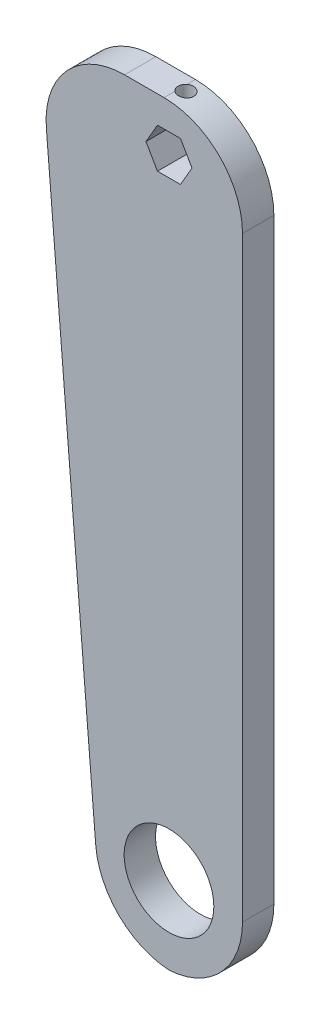
from build123d import *

# Parameters (mm, degrees)
SKETCH1_W                       = 80
SKETCH1_H                       = 10
BOSS_EXTRUDE1_DEPTH             = 120
SKETCH2_R                       = 14.2875
HOLES_DEPTH                     = 127
SKETCH5_W                       = 16.58
SKETCH5_H                       = 240
WEDGE_SHAPE_DEPTH               = 127.885775404
FILLET6_START                   = -6
FILLET6_DEPTH                   = 12
TAP_DRILL_FOR_M6X1_0_TAP1_D     = 5
TAP_DRILL_FOR_M6X1_0_TAP1_DEPTH = 8.651


with BuildPart() as part:
    # Sketch1 → Boss-Extrude1 (new, symmetric)
    with BuildSketch(Plane(origin=(0, 0, 0), x_dir=(1, 0, 0), z_dir=(0, 1, 0))):
        Rectangle(SKETCH1_W, SKETCH1_H)
    extrude(amount=BOSS_EXTRUDE1_DEPTH, both=True)

    # Sketch2 → Holes (cut)
    with BuildSketch(Plane.XY.offset(5)):
        with Locations((0, -95.26)):
            Circle(SKETCH2_R)
        Polygon((3.666174209, 98.65), (7.332348419, 105), (3.666174209, 111.35), (-3.666174209, 111.35), (-7.332348419, 105), (-3.666174209, 98.65), align=None)
    extrude(amount=-HOLES_DEPTH, mode=Mode.SUBTRACT)

    # Sketch5 → Wedge shape (cut, through all)
    with BuildSketch(Plane(origin=(0, 0, -5), x_dir=(-1, 0, 0), z_dir=(0, 0, -1))):
        with BuildLine():
            Line((40, 104.109763944), (21.447331521, -120))
            ThreePointArc((21.447331521, -120), (30.723665761, -120.383309719), (40, -120))
            Line((40, -120), (40, 104.109763944))
        make_face()
        with Locations((-31.71, 0)):
            Rectangle(SKETCH5_W, SKETCH5_H)
    extrude(amount=-WEDGE_SHAPE_DEPTH, mode=Mode.SUBTRACT)

    # Fillet6: read off the stored shape, not the designer's step
    # Fillet6 outline → Fillet6 (cut)
    with BuildSketch(Plane.XY.offset(FILLET6_START)):
        with BuildLine():
            ThreePointArc((-0.005704702, -119.950382649), (-15.93515227, -112.84990156), (-23.346182643, -97.062540783))
            Line((-23.346182643, -97.062540783), (-21.447331521, -120))
            Line((-21.447331521, -120), (23.42, -120))
            Line((23.42, -120), (23.42, -95))
            ThreePointArc((23.42, -95), (16.645769976, -112.112022346), (-0.005704702, -119.950382649))
        make_face()
        with BuildLine():
            Line((-40, 104.109763944), (-39.075113631, 92.937459217))
            ThreePointArc((-39.075113631, 92.937459217), (-32.552777964, 111.932756427), (-14.160340393, 120))
            Line((-14.160340393, 120), (-40, 120))
            Line((-40, 120), (-40, 104.109763944))
        make_face()
        with BuildLine():
            ThreePointArc((-1.58, 120), (16.09766953, 112.67766953), (23.42, 95))
            Line((23.42, 95), (23.42, 120))
            Line((23.42, 120), (-1.58, 120))
        make_face()
    extrude(amount=FILLET6_DEPTH, mode=Mode.SUBTRACT)

    # Tap Drill for M6x1.0 Tap1
    with Locations(Plane(origin=(0, 120, -0.37225415), x_dir=(0, 0, 1), z_dir=(0, 1, 0))):
        with Locations((0, 0)):
            Hole(TAP_DRILL_FOR_M6X1_0_TAP1_D / 2, depth=TAP_DRILL_FOR_M6X1_0_TAP1_DEPTH)


solid = part.part
